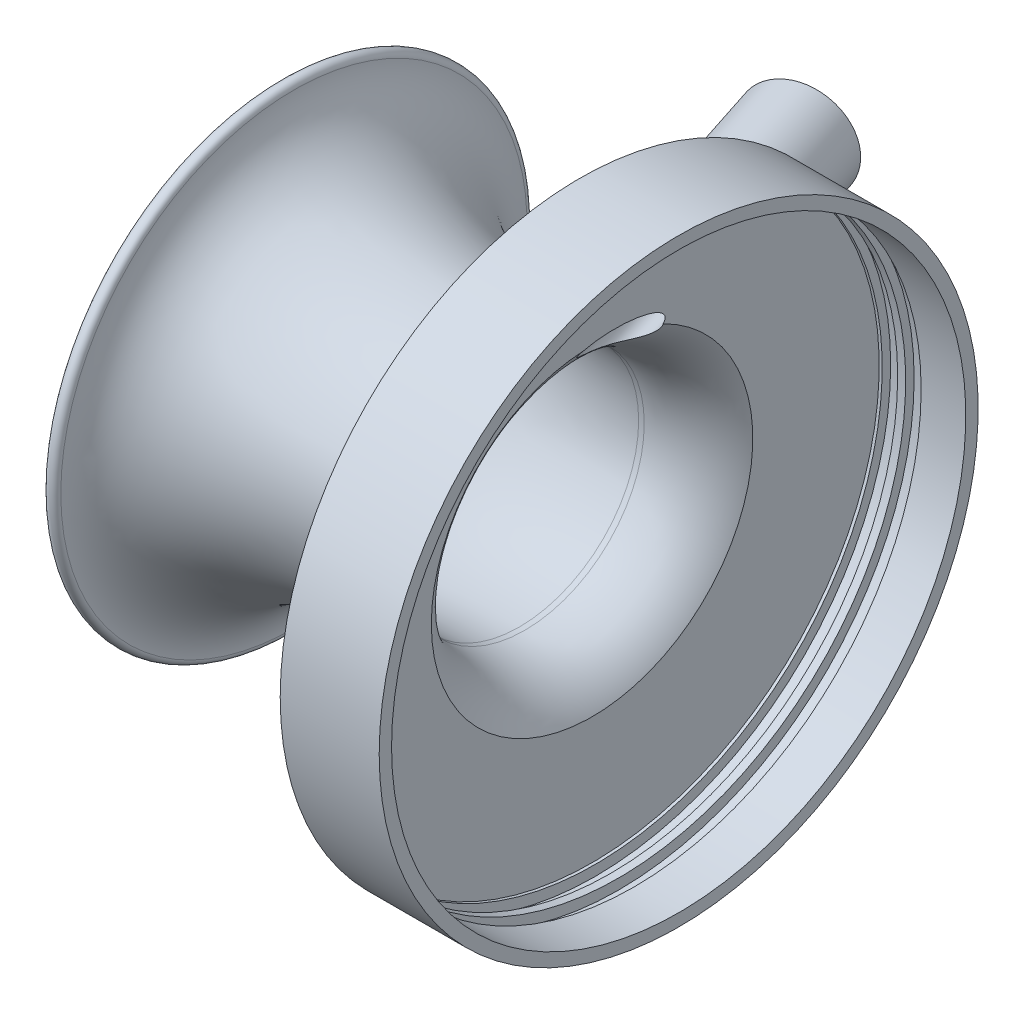
from build123d import *

# Parameters (mm, degrees)
BOSS_EXTRUDE1_REACH      = 139.829
SKETCH2_R                = 5.55625
SKETCH2_R_2              = 3.175
CUT_EXTRUDE1_DEPTH       = 138.828883705
CUT_EXTRUDE1_DEPTH_BACK  = 40.64
SKETCH2_3_R              = 3.175
BOSS_EXTRUDE3_DEPTH      = 25.4
BOSS_EXTRUDE3_DEPTH_BACK = 1.016
SKETCH2_4_R              = 10.16
SKETCH2_4_R_2            = 5.55625
SKETCH5_W                = 3.175
SKETCH5_H                = 2.8575


with BuildPart() as part:
    # Sketch1 → Revolve1 (revolve)
    with BuildSketch(Plane.XY):
        with BuildLine():
            Line((-17.78, 33.403326565), (-17.78, 59.350315565))
            Line((-17.78, 59.350315565), (0, 59.350315565))
            Line((0, 59.350315565), (0, 61.890315565))
            Line((0, 61.890315565), (-20.32, 61.890315565))
            Line((-20.32, 61.890315565), (-20.32, 34.112189466))
            ThreePointArc((-20.32, 34.112189466), (-25.197957931, 29.414317146), (-31.679989745, 27.452751069))
            Line((-31.679989745, 27.452751069), (-32.754114376, 27.428278778))
            add(Edge.make_bspline(
                [(-78.988210727, 48.263572049), (-78.974524565, 47.626969942), (-78.824846785, 46.370836181), (-78.021439697, 43.826156415), (-76.008698515, 40.601424178), (-71.876977344, 36.845746737), (-66.141964212, 33.481114548), (-59.042953877, 30.715957567), (-50.877199882, 28.700991702), (-42.001696553, 27.535499073), (-35.814640326, 27.362481236), (-32.754114376, 27.428278778)],
                knots=[3.141592654, 3.141592654, 3.141592654, 3.141592654, 3.239767424, 3.337942194, 3.534291735, 3.730641276, 3.926990817, 4.123340358, 4.319689899, 4.51603944, 4.71238898, 4.71238898, 4.71238898, 4.71238898], degree=3))
            ThreePointArc((-78.988210727, 48.263572049), (-80.285214463, 49.505981526), (-81.52762394, 48.20897779))
            add(Edge.make_bspline(
                [(-81.52762394, 48.20897779), (-81.003944056, 23.850379885), (-32.699520116, 24.888865565)],
                knots=[3.141592654, 3.141592654, 3.141592654, 4.71238898, 4.71238898, 4.71238898], degree=2, weights=[1, 0.707106781, 1]))
            Line((-32.699520116, 24.888865565), (-31.579850242, 24.914373358))
            ThreePointArc((-31.579850242, 24.914373358), (-23.60359817, 27.409146509), (-17.78, 33.403326565))
        make_face()
    revolve(axis=Axis((-34.322208184, 0.403265565, 0), (1, 0, 0)))


with BuildPart() as body_2:

    # Sketch2 → Boss-Extrude1 (new, up to next)
    with BuildSketch(Plane(origin=(-13.343353817, 0, -41.066620374), x_dir=(0, -1, 0), z_dir=(-0.3090169943749514, 0, -0.9510565162951523)), mode=Mode.PRIVATE) as boss_extrude1_sk1:
        with Locations((-30.889259617, 15.45046582)):
            Circle(SKETCH2_R)
        with Locations((-30.889259617, 15.45046582)):
            Circle(SKETCH2_R_2, mode=Mode.SUBTRACT)
    boss_extrude1_tool1 = extrude(boss_extrude1_sk1.sketch, amount=-BOSS_EXTRUDE1_REACH, mode=Mode.PRIVATE) - part.part
    add(boss_extrude1_tool1.solids().sort_by_distance((-28.03762, 36.288355, -36.292164))[0])


with BuildPart() as part_1:
    add(part.part)

    # Sketch2<3> → Cut-Extrude1 (cut, two sides: drawn at the far end of the back side and taken through both)
    with BuildSketch(Plane(origin=(-13.343353817, 0, -41.066620374), x_dir=(0, -1, 0), z_dir=(-0.3090169943749514, 0, -0.9510565162951523)).offset(-CUT_EXTRUDE1_DEPTH_BACK)):
        with Locations((-30.889259617, 15.45046582)):
            Circle(SKETCH2_3_R)
    extrude(amount=CUT_EXTRUDE1_DEPTH + CUT_EXTRUDE1_DEPTH_BACK, mode=Mode.SUBTRACT)

    add(body_2.part)  # Boss-Extrude3 merges body 2
    # Sketch2<4> → Boss-Extrude3 (add, two sides: drawn at the far end of the back side and taken through both)
    with BuildSketch(Plane(origin=(-13.343353817, 0, -41.066620374), x_dir=(0, -1, 0), z_dir=(-0.3090169943749514, 0, -0.9510565162951523)).offset(-BOSS_EXTRUDE3_DEPTH_BACK)):
        with Locations((-30.889259617, 15.45046582)):
            Circle(SKETCH2_4_R)
        with Locations((-30.889259617, 15.45046582)):
            Circle(SKETCH2_4_R_2, mode=Mode.SUBTRACT)
    extrude(amount=BOSS_EXTRUDE3_DEPTH + BOSS_EXTRUDE3_DEPTH_BACK)

    # Sketch5 → Cut-Revolve2 (revolve, cut)
    with BuildSketch(Plane.XY):
        with Locations((-15.572926281, 59.25506564)):
            Rectangle(SKETCH5_W, SKETCH5_H)
        with Locations((-10.754647864, 59.25506564)):
            Rectangle(SKETCH5_W, SKETCH5_H)
    revolve(axis=Axis((0, 0, 0), (-1, 0, 0)), mode=Mode.SUBTRACT)


solid = part_1.part
